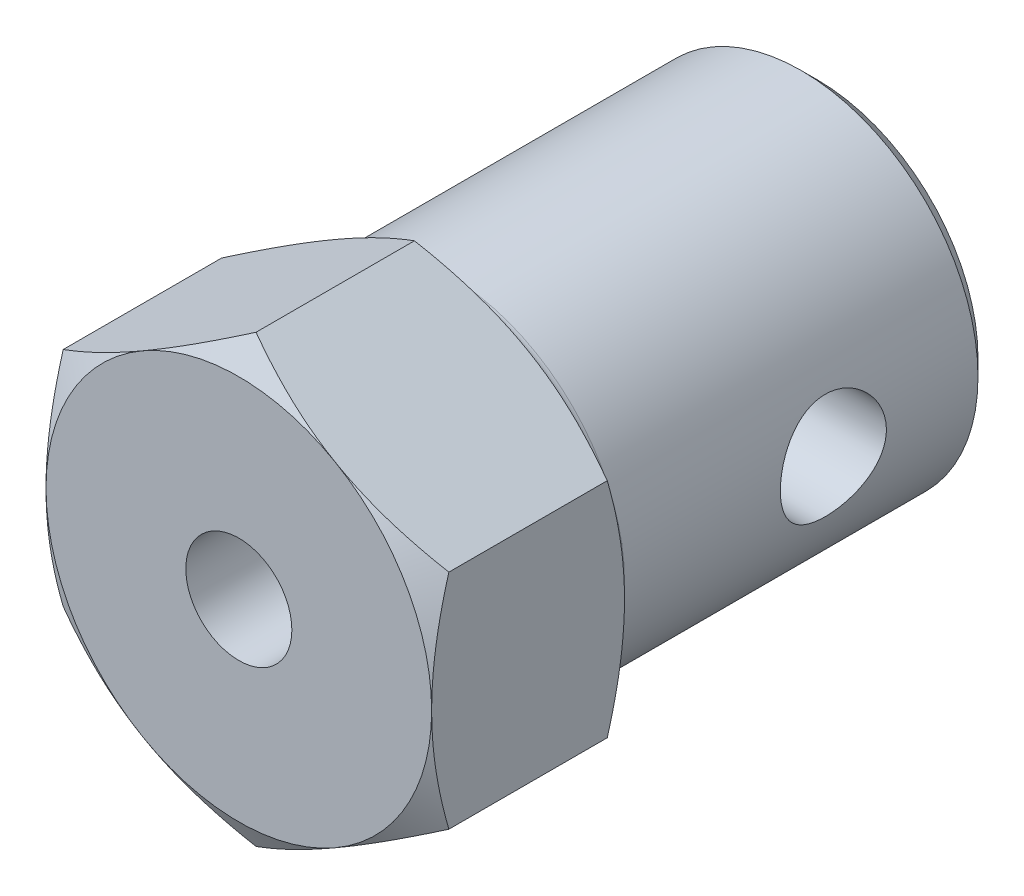
from build123d import *

# Parameters (mm, degrees)
EXTRUDE_1_DEPTH        = 6
SKETCH_2_R             = 5.5
EXTRUDE_2_DEPTH        = 12
SKETCH_3_R             = 2
CUT_EXTRUDE_1_DEPTH    = 12
FILLET_1_R             = 0.5
HOLE_WIZARD_M4_1_D     = 3.3
HOLE_WIZARD_M4_1_DEPTH = 10.1
CHAMFER_1_SIZE         = 0.5
SKETCH_7_OUTSIDE_W     = 39.922
SKETCH_7_OUTSIDE_H     = 41.778
SKETCH_7_OUTSIDE_R     = 6
CUT_EXTRUDE_2_DEPTH    = 6
CUT_EXTRUDE_2_DRAFT    = -60
SKETCH_8_OUTSIDE_W     = 39.922
SKETCH_8_OUTSIDE_H     = 41.778
SKETCH_8_OUTSIDE_R     = 6
CUT_EXTRUDE_3_DEPTH    = 6
CUT_EXTRUDE_3_DRAFT    = 60
SKETCH_19_W            = 1.65
SKETCH_19_H            = 11.5
HOLE_WIZARD_M4_4_D     = 3.3
HOLE_WIZARD_M4_4_DEPTH = 9.2


with BuildPart() as part:
    # 草图1 → 凸台-拉伸1 (new body)
    with BuildSketch(Plane.XY):
        Polygon((-6, 3.464101615), (-6, -3.464101615), (0, -6.92820323), (6, -3.464101615), (6, 3.464101615), (0, 6.92820323), align=None)
    extrude(amount=EXTRUDE_1_DEPTH)

    # 草图2 → 凸台-拉伸2 (add)
    with BuildSketch(Plane.XY):
        Circle(SKETCH_2_R)
    extrude(amount=-EXTRUDE_2_DEPTH)

    # 草图3 → 切除-拉伸1 (cut)
    with BuildSketch(Plane(origin=(0, 0, -12), x_dir=(-1, 0, 0), z_dir=(0, 0, -1))):
        Circle(SKETCH_3_R)
    extrude(amount=-CUT_EXTRUDE_1_DEPTH, mode=Mode.SUBTRACT)

    # 圆角1
    fillet_1_edges = [part.edges().sort_by_distance(p)[0] for p in [
        (-5.5, 0, 0),
    ]]
    fillet(fillet_1_edges, radius=FILLET_1_R - 0.0001)  # a hair under: the kernel refuses the full size

    # M4 螺纹孔1
    with Locations(Plane.XY.offset(6)):
        with Locations((0, 0)):
            Hole(HOLE_WIZARD_M4_1_D / 2, depth=HOLE_WIZARD_M4_1_DEPTH)

    # 倒角1
    chamfer_1_edges = [part.edges().sort_by_distance(p)[0] for p in [
        (-5.5, 0, -12),
    ]]
    chamfer(chamfer_1_edges, length=CHAMFER_1_SIZE)


with BuildPart() as cut_extrude_2_tool:
    # 草图7 outside → 切除-拉伸2 (with draft: the straight prism first)
    with BuildSketch(Plane.XY.offset(6)):
        Rectangle(SKETCH_7_OUTSIDE_W, SKETCH_7_OUTSIDE_H)
        Circle(SKETCH_7_OUTSIDE_R, mode=Mode.SUBTRACT)
    extrude(amount=-CUT_EXTRUDE_2_DEPTH)
    # 切除-拉伸2: the draft: its side faces are tilted about the plane it starts from
    cut_extrude_2_sides = [cut_extrude_2_tool.faces().sort_by_distance(p)[0] for p in [
        (0, -20.889, 3),
        (19.961, 0, 3),
        (0, 20.889, 3),
        (-19.961, 0, 3),
        (-6, 0, 3),
    ]]
    draft(cut_extrude_2_sides, Plane.XY.offset(6), CUT_EXTRUDE_2_DRAFT)


with BuildPart() as part_1:
    add(part.part)

    # 切除-拉伸2: cut by cut_extrude_2_tool
    add(cut_extrude_2_tool.part, mode=Mode.SUBTRACT)


with BuildPart() as cut_extrude_3_tool:
    # 草图8 outside → 切除-拉伸3 (with draft: the straight prism first)
    with BuildSketch(Plane.XY):
        Rectangle(SKETCH_8_OUTSIDE_W, SKETCH_8_OUTSIDE_H)
        Circle(SKETCH_8_OUTSIDE_R, mode=Mode.SUBTRACT)
    extrude(amount=CUT_EXTRUDE_3_DEPTH)
    # 切除-拉伸3: the draft: its side faces are tilted about the plane it starts from
    cut_extrude_3_sides = [cut_extrude_3_tool.faces().sort_by_distance(p)[0] for p in [
        (0, -20.889, 3),
        (19.961, 0, 3),
        (0, 20.889, 3),
        (-19.961, 0, 3),
        (-6, 0, 3),
    ]]
    draft(cut_extrude_3_sides, Plane.XY, CUT_EXTRUDE_3_DRAFT)


with BuildPart() as part_2:
    add(part_1.part)

    # 切除-拉伸3: cut by cut_extrude_3_tool
    add(cut_extrude_3_tool.part, mode=Mode.SUBTRACT)

    # 草图19 → M4 螺纹孔3 (revolve, cut)
    with BuildSketch(Plane(origin=(0, 0, -7), x_dir=(0, 0, 1), z_dir=(0, 1, 0))):
        with Locations((0.825, 5.75)):
            Rectangle(SKETCH_19_W, SKETCH_19_H)
    revolve(axis=Axis((-6.35, 0, -7), (1, 0, 0)), mode=Mode.SUBTRACT)

    # M4 螺纹孔4
    with Locations(Plane(origin=(0, 0, 0), x_dir=(0, 0, -1), z_dir=(1, 0, 0))):
        with Locations((7, 0)):
            Hole(HOLE_WIZARD_M4_4_D / 2, depth=HOLE_WIZARD_M4_4_DEPTH)


solid = part_2.part
